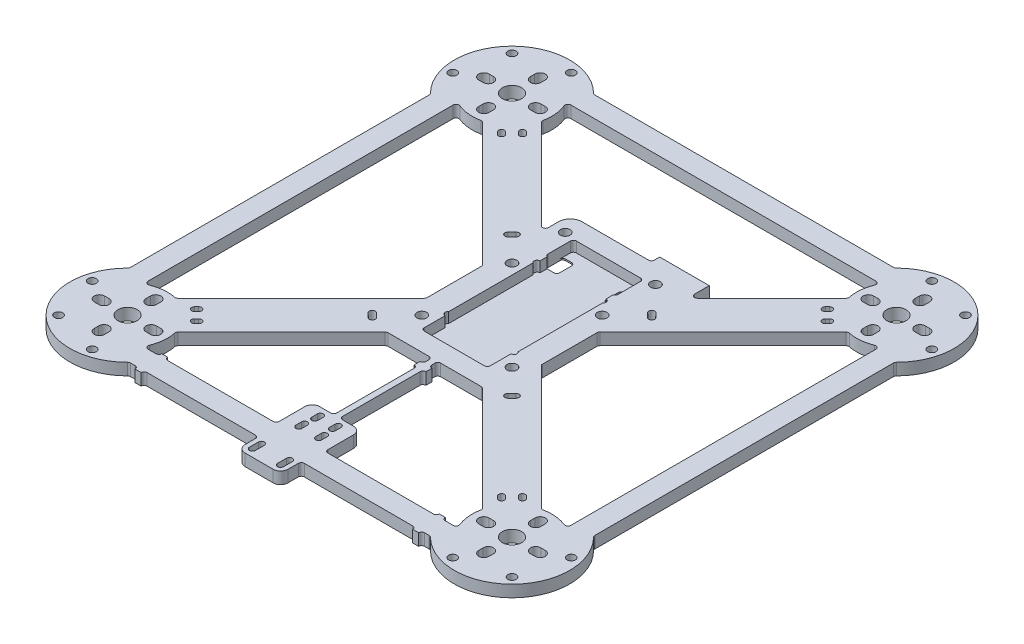
from build123d import *

# Parameters (mm, degrees)
BASE_SHAPE_DEPTH           = 4
MOTOR_MOUNTING_HOLES_REACH = 113.088
SKETCH2_R                  = 3.25
OSD_COVER_DEPTH            = 4
MAIN_HOLES_REACH           = 113.088
SKETCH7_R                  = 1.65
SKETCH8_W                  = 7.5
SKETCH8_H                  = 7
SKETCH8_W_2                = 2
SKETCH8_H_2                = 34.8
SKETCH8_H_3                = 12.2
SKETCH8_H_4                = 1.6
VTX_MOUNT_DEPTH            = 4
SKETCH9_R                  = 1
ESC_CUTS_DEPTH             = 4
MOTOR_START                = -4
MOTOR_PROTECTORS_OUTLINE_R = 1.4
MOTOR_PROTECTORS_DEPTH     = 4
VTX_START                  = -3.5
VTX_POCKET_DEPTH           = 3.5
SKETCH13_W                 = 4
SKETCH13_H                 = 2
SKETCH13_W_2               = 2
SKETCH13_H_2               = 1
CLIP_RETAINERS_DEPTH       = 4
MILLING_FILLETS_R          = 1


with BuildPart() as part:
    # Sketch1 → Base shape (new body)
    with BuildSketch(Plane(origin=(0, 0, 0), x_dir=(1, 0, 0), z_dir=(0, 1, 0))):
        with BuildLine():
            Line((78.5, -65), (78.5, 65))
            ThreePointArc((78.5, 65), (74.5459415, 74.545941592), (64.999999869, 78.5))
            Line((64.999999869, 78.5), (-65, 78.5))
            ThreePointArc((-65, 78.5), (-74.545941546, 74.545941546), (-78.5, 65))
            Line((-78.5, 65), (-78.5, -65))
            ThreePointArc((-78.5, -65), (-74.545941546, -74.545941546), (-65, -78.5))
            Line((-65, -78.5), (65, -78.5))
            ThreePointArc((65, -78.5), (74.545941546, -74.545941546), (78.5, -65))
        make_face()
        with BuildLine():
            Line((0, -9.899494937), (51.887838673, -61.78733361))
            ThreePointArc((51.887838673, -61.78733361), (51.615727203, -66.763871223), (53.167840434, -71.5))
            Line((53.167840434, -71.5), (-53.167840434, -71.5))
            ThreePointArc((-53.167840434, -71.5), (-51.615727203, -66.763871223), (-51.887838673, -61.78733361))
            Line((-51.887838673, -61.78733361), (0, -9.899494937))
        make_face(mode=Mode.SUBTRACT)
        with BuildLine():
            Line((-61.78733361, 51.887838673), (-9.899494937, 0))
            Line((-9.899494937, 0), (-61.78733361, -51.887838673))
            ThreePointArc((-61.78733361, -51.887838673), (-66.763871223, -51.615727203), (-71.5, -53.167840434))
            Line((-71.5, -53.167840434), (-71.5, 53.167840434))
            ThreePointArc((-71.5, 53.167840434), (-66.763871223, 51.615727203), (-61.78733361, 51.887838673))
        make_face(mode=Mode.SUBTRACT)
        with BuildLine():
            Line((61.78733361, -51.887838673), (9.899494937, 0))
            Line((9.899494937, 0), (61.78733361, 51.887838673))
            ThreePointArc((61.78733361, 51.887838673), (66.763871223, 51.615727203), (71.5, 53.167840434))
            Line((71.5, 53.167840434), (71.5, -53.167840434))
            ThreePointArc((71.5, -53.167840434), (66.763871223, -51.615727203), (61.78733361, -51.887838673))
        make_face(mode=Mode.SUBTRACT)
        with BuildLine():
            Line((51.887838673, 61.78733361), (0, 9.899494937))
            Line((0, 9.899494937), (-51.887838673, 61.78733361))
            ThreePointArc((-51.887838673, 61.78733361), (-51.615727203, 66.763871223), (-53.167840434, 71.5))
            Line((-53.167840434, 71.5), (53.167840434, 71.5))
            ThreePointArc((53.167840434, 71.5), (51.615727203, 66.763871223), (51.887838673, 61.78733361))
        make_face(mode=Mode.SUBTRACT)
    extrude(amount=BASE_SHAPE_DEPTH)

    # Sketch2 → Motor mounting holes (cut, up to next)
    with BuildSketch(Plane(origin=(0, 4, 0), x_dir=(1, 0, 0), z_dir=(0, 1, 0)), mode=Mode.PRIVATE) as motor_mounting_holes_sk1:
        with BuildLine():
            ThreePointArc((-66.75, 73), (-65, 71.25), (-63.25, 73))
            Line((-63.25, 73), (-63.25, 74.337424698))
            ThreePointArc((-63.25, 74.337424698), (-63.253719245, 74.338120985), (-63.257438767, 74.338815789))
            ThreePointArc((-63.257438767, 74.338815789), (-65, 76.25), (-66.742561233, 74.338815789))
            ThreePointArc((-66.742561233, 74.338815789), (-66.746280755, 74.338120985), (-66.75, 74.337424698))
            Line((-66.75, 74.337424698), (-66.75, 73))
        make_face()
    motor_mounting_holes_tool1 = extrude(motor_mounting_holes_sk1.sketch, amount=-MOTOR_MOUNTING_HOLES_REACH, mode=Mode.PRIVATE) & part.part
    # Sketch2 → Motor mounting holes (cut, up to next)
    with BuildSketch(Plane(origin=(0, 4, 0), x_dir=(1, 0, 0), z_dir=(0, 1, 0)), mode=Mode.PRIVATE) as motor_mounting_holes_sk2:
        with BuildLine():
            Line((-73, 66.75), (-74.337424698, 66.75))
            ThreePointArc((-74.337424698, 66.75), (-74.338120985, 66.746280755), (-74.338815789, 66.742561233))
            ThreePointArc((-74.338815789, 66.742561233), (-76.25, 65), (-74.338815789, 63.257438767))
            ThreePointArc((-74.338815789, 63.257438767), (-74.338120985, 63.253719245), (-74.337424698, 63.25))
            Line((-74.337424698, 63.25), (-73, 63.25))
            ThreePointArc((-73, 63.25), (-71.25, 65), (-73, 66.75))
        make_face()
    motor_mounting_holes_tool2 = extrude(motor_mounting_holes_sk2.sketch, amount=-MOTOR_MOUNTING_HOLES_REACH, mode=Mode.PRIVATE) & part.part
    # Sketch2 → Motor mounting holes (cut, up to next)
    with BuildSketch(Plane(origin=(0, 4, 0), x_dir=(1, 0, 0), z_dir=(0, 1, 0)), mode=Mode.PRIVATE) as motor_mounting_holes_sk3:
        with BuildLine():
            ThreePointArc((-55.662575302, 63.25), (-55.661879015, 63.253719245), (-55.661184211, 63.257438767))
            ThreePointArc((-55.661184211, 63.257438767), (-53.75, 65), (-55.661184211, 66.742561233))
            ThreePointArc((-55.661184211, 66.742561233), (-55.661879015, 66.746280755), (-55.662575302, 66.75))
            Line((-55.662575302, 66.75), (-57, 66.75))
            ThreePointArc((-57, 66.75), (-58.75, 65), (-57, 63.25))
            Line((-57, 63.25), (-55.662575302, 63.25))
        make_face()
    motor_mounting_holes_tool3 = extrude(motor_mounting_holes_sk3.sketch, amount=-MOTOR_MOUNTING_HOLES_REACH, mode=Mode.PRIVATE) & part.part
    # Sketch2 → Motor mounting holes (cut, up to next)
    with BuildSketch(Plane(origin=(0, 4, 0), x_dir=(1, 0, 0), z_dir=(0, 1, 0)), mode=Mode.PRIVATE) as motor_mounting_holes_sk4:
        with BuildLine():
            ThreePointArc((-66.742561233, 55.661184211), (-65, 53.75), (-63.257438767, 55.661184211))
            ThreePointArc((-63.257438767, 55.661184211), (-63.253719245, 55.661879015), (-63.25, 55.662575302))
            Line((-63.25, 55.662575302), (-63.25, 57))
            ThreePointArc((-63.25, 57), (-65, 58.75), (-66.75, 57))
            Line((-66.75, 57), (-66.75, 55.662575302))
            ThreePointArc((-66.75, 55.662575302), (-66.746280755, 55.661879015), (-66.742561233, 55.661184211))
        make_face()
    motor_mounting_holes_tool4 = extrude(motor_mounting_holes_sk4.sketch, amount=-MOTOR_MOUNTING_HOLES_REACH, mode=Mode.PRIVATE) & part.part
    # Sketch2 → Motor mounting holes (cut, up to next)
    with BuildSketch(Plane(origin=(0, 4, 0), x_dir=(1, 0, 0), z_dir=(0, 1, 0)), mode=Mode.PRIVATE) as motor_mounting_holes_sk5:
        with BuildLine():
            ThreePointArc((63.25, 55.5), (65, 53.75), (66.75, 55.5))
            Line((66.75, 55.5), (66.75, 57))
            ThreePointArc((66.75, 57), (65, 58.75), (63.25, 57))
            Line((63.25, 57), (63.25, 55.5))
        make_face()
    motor_mounting_holes_tool5 = extrude(motor_mounting_holes_sk5.sketch, amount=-MOTOR_MOUNTING_HOLES_REACH, mode=Mode.PRIVATE) & part.part
    # Sketch2 → Motor mounting holes (cut, up to next)
    with BuildSketch(Plane(origin=(0, 4, 0), x_dir=(1, 0, 0), z_dir=(0, 1, 0)), mode=Mode.PRIVATE) as motor_mounting_holes_sk6:
        with BuildLine():
            ThreePointArc((74.5, 63.25), (76.25, 65), (74.5, 66.75))
            Line((74.5, 66.75), (73, 66.75))
            ThreePointArc((73, 66.75), (71.25, 65), (73, 63.25))
            Line((73, 63.25), (74.5, 63.25))
        make_face()
    motor_mounting_holes_tool6 = extrude(motor_mounting_holes_sk6.sketch, amount=-MOTOR_MOUNTING_HOLES_REACH, mode=Mode.PRIVATE) & part.part
    # Sketch2 → Motor mounting holes (cut, up to next)
    with BuildSketch(Plane(origin=(0, 4, 0), x_dir=(1, 0, 0), z_dir=(0, 1, 0)), mode=Mode.PRIVATE) as motor_mounting_holes_sk7:
        with BuildLine():
            ThreePointArc((63.25, 73), (65, 71.25), (66.75, 73))
            Line((66.75, 73), (66.75, 74.5))
            ThreePointArc((66.75, 74.5), (65, 76.25), (63.25, 74.5))
            Line((63.25, 74.5), (63.25, 73))
        make_face()
    motor_mounting_holes_tool7 = extrude(motor_mounting_holes_sk7.sketch, amount=-MOTOR_MOUNTING_HOLES_REACH, mode=Mode.PRIVATE) & part.part
    # Sketch2 → Motor mounting holes (cut, up to next)
    with BuildSketch(Plane(origin=(0, 4, 0), x_dir=(1, 0, 0), z_dir=(0, 1, 0)), mode=Mode.PRIVATE) as motor_mounting_holes_sk8:
        with BuildLine():
            ThreePointArc((55.5, 66.75), (53.75, 65), (55.5, 63.25))
            Line((55.5, 63.25), (57, 63.25))
            ThreePointArc((57, 63.25), (58.75, 65), (57, 66.75))
            Line((57, 66.75), (55.5, 66.75))
        make_face()
    motor_mounting_holes_tool8 = extrude(motor_mounting_holes_sk8.sketch, amount=-MOTOR_MOUNTING_HOLES_REACH, mode=Mode.PRIVATE) & part.part
    # Sketch2 → Motor mounting holes (cut, up to next)
    with BuildSketch(Plane(origin=(0, 4, 0), x_dir=(1, 0, 0), z_dir=(0, 1, 0)), mode=Mode.PRIVATE) as motor_mounting_holes_sk9:
        with BuildLine():
            ThreePointArc((-66.75, -57), (-65, -58.75), (-63.25, -57))
            Line((-63.25, -57), (-63.25, -55.5))
            ThreePointArc((-63.25, -55.5), (-65, -53.75), (-66.75, -55.5))
            Line((-66.75, -55.5), (-66.75, -57))
        make_face()
    motor_mounting_holes_tool9 = extrude(motor_mounting_holes_sk9.sketch, amount=-MOTOR_MOUNTING_HOLES_REACH, mode=Mode.PRIVATE) & part.part
    # Sketch2 → Motor mounting holes (cut, up to next)
    with BuildSketch(Plane(origin=(0, 4, 0), x_dir=(1, 0, 0), z_dir=(0, 1, 0)), mode=Mode.PRIVATE) as motor_mounting_holes_sk10:
        with BuildLine():
            ThreePointArc((-57, -63.25), (-58.75, -65), (-57, -66.75))
            Line((-57, -66.75), (-55.5, -66.75))
            ThreePointArc((-55.5, -66.75), (-53.75, -65), (-55.5, -63.25))
            Line((-55.5, -63.25), (-57, -63.25))
        make_face()
    motor_mounting_holes_tool10 = extrude(motor_mounting_holes_sk10.sketch, amount=-MOTOR_MOUNTING_HOLES_REACH, mode=Mode.PRIVATE) & part.part
    # Sketch2 → Motor mounting holes (cut, up to next)
    with BuildSketch(Plane(origin=(0, 4, 0), x_dir=(1, 0, 0), z_dir=(0, 1, 0)), mode=Mode.PRIVATE) as motor_mounting_holes_sk11:
        with BuildLine():
            ThreePointArc((-74.5, -63.25), (-76.25, -65), (-74.5, -66.75))
            Line((-74.5, -66.75), (-73, -66.75))
            ThreePointArc((-73, -66.75), (-71.25, -65), (-73, -63.25))
            Line((-73, -63.25), (-74.5, -63.25))
        make_face()
    motor_mounting_holes_tool11 = extrude(motor_mounting_holes_sk11.sketch, amount=-MOTOR_MOUNTING_HOLES_REACH, mode=Mode.PRIVATE) & part.part
    # Sketch2 → Motor mounting holes (cut, up to next)
    with BuildSketch(Plane(origin=(0, 4, 0), x_dir=(1, 0, 0), z_dir=(0, 1, 0)), mode=Mode.PRIVATE) as motor_mounting_holes_sk12:
        with BuildLine():
            ThreePointArc((-63.25, -73), (-65, -71.25), (-66.75, -73))
            Line((-66.75, -73), (-66.75, -74.5))
            ThreePointArc((-66.75, -74.5), (-65, -76.25), (-63.25, -74.5))
            Line((-63.25, -74.5), (-63.25, -73))
        make_face()
    motor_mounting_holes_tool12 = extrude(motor_mounting_holes_sk12.sketch, amount=-MOTOR_MOUNTING_HOLES_REACH, mode=Mode.PRIVATE) & part.part
    # Sketch2 → Motor mounting holes (cut, up to next)
    with BuildSketch(Plane(origin=(0, 4, 0), x_dir=(1, 0, 0), z_dir=(0, 1, 0)), mode=Mode.PRIVATE) as motor_mounting_holes_sk13:
        with BuildLine():
            ThreePointArc((55.5, -63.25), (53.75, -65), (55.5, -66.75))
            Line((55.5, -66.75), (57, -66.75))
            ThreePointArc((57, -66.75), (58.75, -65), (57, -63.25))
            Line((57, -63.25), (55.5, -63.25))
        make_face()
    motor_mounting_holes_tool13 = extrude(motor_mounting_holes_sk13.sketch, amount=-MOTOR_MOUNTING_HOLES_REACH, mode=Mode.PRIVATE) & part.part
    # Sketch2 → Motor mounting holes (cut, up to next)
    with BuildSketch(Plane(origin=(0, 4, 0), x_dir=(1, 0, 0), z_dir=(0, 1, 0)), mode=Mode.PRIVATE) as motor_mounting_holes_sk14:
        with BuildLine():
            ThreePointArc((66.75, -73), (65, -71.25), (63.25, -73))
            Line((63.25, -73), (63.25, -74.5))
            ThreePointArc((63.25, -74.5), (65, -76.25), (66.75, -74.5))
            Line((66.75, -74.5), (66.75, -73))
        make_face()
    motor_mounting_holes_tool14 = extrude(motor_mounting_holes_sk14.sketch, amount=-MOTOR_MOUNTING_HOLES_REACH, mode=Mode.PRIVATE) & part.part
    # Sketch2 → Motor mounting holes (cut, up to next)
    with BuildSketch(Plane(origin=(0, 4, 0), x_dir=(1, 0, 0), z_dir=(0, 1, 0)), mode=Mode.PRIVATE) as motor_mounting_holes_sk15:
        with BuildLine():
            ThreePointArc((74.5, -66.75), (76.25, -65), (74.5, -63.25))
            Line((74.5, -63.25), (73, -63.25))
            ThreePointArc((73, -63.25), (71.25, -65), (73, -66.75))
            Line((73, -66.75), (74.5, -66.75))
        make_face()
    motor_mounting_holes_tool15 = extrude(motor_mounting_holes_sk15.sketch, amount=-MOTOR_MOUNTING_HOLES_REACH, mode=Mode.PRIVATE) & part.part
    # Sketch2 → Motor mounting holes (cut, up to next)
    with BuildSketch(Plane(origin=(0, 4, 0), x_dir=(1, 0, 0), z_dir=(0, 1, 0)), mode=Mode.PRIVATE) as motor_mounting_holes_sk16:
        with BuildLine():
            ThreePointArc((66.75, -55.5), (65, -53.75), (63.25, -55.5))
            Line((63.25, -55.5), (63.25, -57))
            ThreePointArc((63.25, -57), (65, -58.75), (66.75, -57))
            Line((66.75, -57), (66.75, -55.5))
        make_face()
    motor_mounting_holes_tool16 = extrude(motor_mounting_holes_sk16.sketch, amount=-MOTOR_MOUNTING_HOLES_REACH, mode=Mode.PRIVATE) & part.part
    # Sketch2 → Motor mounting holes (cut, up to next)
    with BuildSketch(Plane(origin=(0, 4, 0), x_dir=(1, 0, 0), z_dir=(0, 1, 0)), mode=Mode.PRIVATE) as motor_mounting_holes_sk17:
        with Locations(Location((-65, 65, 0), (0, 0, 270))):
            Circle(SKETCH2_R)
    motor_mounting_holes_tool17 = extrude(motor_mounting_holes_sk17.sketch, amount=-MOTOR_MOUNTING_HOLES_REACH, mode=Mode.PRIVATE) & part.part
    # Sketch2 → Motor mounting holes (cut, up to next)
    with BuildSketch(Plane(origin=(0, 4, 0), x_dir=(1, 0, 0), z_dir=(0, 1, 0)), mode=Mode.PRIVATE) as motor_mounting_holes_sk18:
        with Locations(Location((65, 65, 0), (0, 0, 270))):
            Circle(SKETCH2_R)
    motor_mounting_holes_tool18 = extrude(motor_mounting_holes_sk18.sketch, amount=-MOTOR_MOUNTING_HOLES_REACH, mode=Mode.PRIVATE) & part.part
    # Sketch2 → Motor mounting holes (cut, up to next)
    with BuildSketch(Plane(origin=(0, 4, 0), x_dir=(1, 0, 0), z_dir=(0, 1, 0)), mode=Mode.PRIVATE) as motor_mounting_holes_sk19:
        with Locations(Location((65, -65, 0), (0, 0, 270))):
            Circle(SKETCH2_R)
    motor_mounting_holes_tool19 = extrude(motor_mounting_holes_sk19.sketch, amount=-MOTOR_MOUNTING_HOLES_REACH, mode=Mode.PRIVATE) & part.part
    # Sketch2 → Motor mounting holes (cut, up to next)
    with BuildSketch(Plane(origin=(0, 4, 0), x_dir=(1, 0, 0), z_dir=(0, 1, 0)), mode=Mode.PRIVATE) as motor_mounting_holes_sk20:
        with Locations(Location((-65, -65, 0), (0, 0, 270))):
            Circle(SKETCH2_R)
    motor_mounting_holes_tool20 = extrude(motor_mounting_holes_sk20.sketch, amount=-MOTOR_MOUNTING_HOLES_REACH, mode=Mode.PRIVATE) & part.part
    add(motor_mounting_holes_tool1.solids().sort_by_distance((-65, 4, -73.749966))[0], mode=Mode.SUBTRACT)
    add(motor_mounting_holes_tool2.solids().sort_by_distance((-73.749966, 4, -65))[0], mode=Mode.SUBTRACT)
    add(motor_mounting_holes_tool3.solids().sort_by_distance((-56.250034, 4, -65))[0], mode=Mode.SUBTRACT)
    add(motor_mounting_holes_tool4.solids().sort_by_distance((-65, 4, -56.250034))[0], mode=Mode.SUBTRACT)
    add(motor_mounting_holes_tool5.solids().sort_by_distance((65, 4, -56.25))[0], mode=Mode.SUBTRACT)
    add(motor_mounting_holes_tool6.solids().sort_by_distance((73.75, 4, -65))[0], mode=Mode.SUBTRACT)
    add(motor_mounting_holes_tool7.solids().sort_by_distance((65, 4, -73.75))[0], mode=Mode.SUBTRACT)
    add(motor_mounting_holes_tool8.solids().sort_by_distance((56.25, 4, -65))[0], mode=Mode.SUBTRACT)
    add(motor_mounting_holes_tool9.solids().sort_by_distance((-65, 4, 56.25))[0], mode=Mode.SUBTRACT)
    add(motor_mounting_holes_tool10.solids().sort_by_distance((-56.25, 4, 65))[0], mode=Mode.SUBTRACT)
    add(motor_mounting_holes_tool11.solids().sort_by_distance((-73.75, 4, 65))[0], mode=Mode.SUBTRACT)
    add(motor_mounting_holes_tool12.solids().sort_by_distance((-65, 4, 73.75))[0], mode=Mode.SUBTRACT)
    add(motor_mounting_holes_tool13.solids().sort_by_distance((56.25, 4, 65))[0], mode=Mode.SUBTRACT)
    add(motor_mounting_holes_tool14.solids().sort_by_distance((65, 4, 73.75))[0], mode=Mode.SUBTRACT)
    add(motor_mounting_holes_tool15.solids().sort_by_distance((73.75, 4, 65))[0], mode=Mode.SUBTRACT)
    add(motor_mounting_holes_tool16.solids().sort_by_distance((65, 4, 56.25))[0], mode=Mode.SUBTRACT)
    add(motor_mounting_holes_tool17.solids().sort_by_distance((-65, 4, -65))[0], mode=Mode.SUBTRACT)
    add(motor_mounting_holes_tool18.solids().sort_by_distance((65, 4, -65))[0], mode=Mode.SUBTRACT)
    add(motor_mounting_holes_tool19.solids().sort_by_distance((65, 4, 65))[0], mode=Mode.SUBTRACT)
    add(motor_mounting_holes_tool20.solids().sort_by_distance((-65, 4, 65))[0], mode=Mode.SUBTRACT)

    # Sketch5 → OSD cover (add)
    with BuildSketch(Plane.XZ):
        Polygon((-19.5, 9.600505063), (-19.5, -9.600505063), (-9.899494937, 0), align=None)
        Polygon((0, 9.899494937), (16.200505063, 26.1), (-16.200505063, 26.1), align=None)
        with BuildLine():
            Line((-19.5, -29.399494937), (-19.5, -35.2))
            ThreePointArc((-19.5, -35.2), (-18.328427125, -38.028427125), (-15.5, -39.2))
            Line((-15.5, -39.2), (6.95, -39.2))
            ThreePointArc((6.95, -39.2), (7.657106781, -39.492893219), (7.95, -40.2))
            Line((7.95, -40.2), (7.95, -42))
            Line((7.95, -42), (24.7, -42))
            Line((24.7, -42), (24.7, -34.599494937))
            Line((24.7, -34.599494937), (0, -9.899494937))
            Line((0, -9.899494937), (-19.5, -29.399494937))
        make_face()
        Polygon((19.5, -9.600505063), (19.5, 9.600505063), (9.899494937, 0), align=None)
    extrude(amount=-OSD_COVER_DEPTH)

    # Sketch7 → Main holes (cut, up to next)
    with BuildSketch(Plane(origin=(0, 4, 0), x_dir=(1, 0, 0), z_dir=(0, 1, 0)), mode=Mode.PRIVATE) as main_holes_sk1:
        with BuildLine():
            Line((-10.85, 23), (-8.85, 23))
            ThreePointArc((-8.85, 23), (-8.142893219, 23.292893219), (-7.85, 24))
            Line((-7.85, 24), (-7.85, 28))
            ThreePointArc((-7.85, 28), (-8.142893219, 28.707106781), (-8.85, 29))
            Line((-8.85, 29), (-10.85, 29))
            ThreePointArc((-10.85, 29), (-11.557106781, 28.707106781), (-11.85, 28))
            Line((-11.85, 28), (-11.85, 24))
            ThreePointArc((-11.85, 24), (-11.557106781, 23.292893219), (-10.85, 23))
        make_face()
    main_holes_tool1 = extrude(main_holes_sk1.sketch, amount=-MAIN_HOLES_REACH, mode=Mode.PRIVATE) & part.part
    # Sketch7 → Main holes (cut, up to next)
    with BuildSketch(Plane(origin=(0, 4, 0), x_dir=(1, 0, 0), z_dir=(0, 1, 0)), mode=Mode.PRIVATE) as main_holes_sk2:
        with BuildLine():
            Line((10.85, 29), (8.85, 29))
            ThreePointArc((8.85, 29), (8.142893219, 28.707106781), (7.85, 28))
            Line((7.85, 28), (7.85, 24))
            ThreePointArc((7.85, 24), (8.142893219, 23.292893219), (8.85, 23))
            Line((8.85, 23), (10.85, 23))
            ThreePointArc((10.85, 23), (11.557106781, 23.292893219), (11.85, 24))
            Line((11.85, 24), (11.85, 28))
            ThreePointArc((11.85, 28), (11.557106781, 28.707106781), (10.85, 29))
        make_face()
    main_holes_tool2 = extrude(main_holes_sk2.sketch, amount=-MAIN_HOLES_REACH, mode=Mode.PRIVATE) & part.part
    # Sketch7 → Main holes (cut, up to next)
    with BuildSketch(Plane(origin=(0, 4, 0), x_dir=(1, 0, 0), z_dir=(0, 1, 0)), mode=Mode.PRIVATE) as main_holes_sk3:
        with Locations(Location((-15.25, -15.25, 0), (0, 0, 270))):
            Circle(SKETCH7_R)
    main_holes_tool3 = extrude(main_holes_sk3.sketch, amount=-MAIN_HOLES_REACH, mode=Mode.PRIVATE) & part.part
    # Sketch7 → Main holes (cut, up to next)
    with BuildSketch(Plane(origin=(0, 4, 0), x_dir=(1, 0, 0), z_dir=(0, 1, 0)), mode=Mode.PRIVATE) as main_holes_sk4:
        with Locations(Location((-15.25, 15.25, 0), (0, 0, 270))):
            Circle(SKETCH7_R)
    main_holes_tool4 = extrude(main_holes_sk4.sketch, amount=-MAIN_HOLES_REACH, mode=Mode.PRIVATE) & part.part
    # Sketch7 → Main holes (cut, up to next)
    with BuildSketch(Plane(origin=(0, 4, 0), x_dir=(1, 0, 0), z_dir=(0, 1, 0)), mode=Mode.PRIVATE) as main_holes_sk5:
        with Locations(Location((-15.25, 33.25, 0), (0, 0, 270))):
            Circle(SKETCH7_R)
    main_holes_tool5 = extrude(main_holes_sk5.sketch, amount=-MAIN_HOLES_REACH, mode=Mode.PRIVATE) & part.part
    # Sketch7 → Main holes (cut, up to next)
    with BuildSketch(Plane(origin=(0, 4, 0), x_dir=(1, 0, 0), z_dir=(0, 1, 0)), mode=Mode.PRIVATE) as main_holes_sk6:
        with Locations(Location((15.25, 33.25, 0), (0, 0, 270))):
            Circle(SKETCH7_R)
    main_holes_tool6 = extrude(main_holes_sk6.sketch, amount=-MAIN_HOLES_REACH, mode=Mode.PRIVATE) & part.part
    # Sketch7 → Main holes (cut, up to next)
    with BuildSketch(Plane(origin=(0, 4, 0), x_dir=(1, 0, 0), z_dir=(0, 1, 0)), mode=Mode.PRIVATE) as main_holes_sk7:
        with Locations(Location((15.25, 15.25, 0), (0, 0, 270))):
            Circle(SKETCH7_R)
    main_holes_tool7 = extrude(main_holes_sk7.sketch, amount=-MAIN_HOLES_REACH, mode=Mode.PRIVATE) & part.part
    # Sketch7 → Main holes (cut, up to next)
    with BuildSketch(Plane(origin=(0, 4, 0), x_dir=(1, 0, 0), z_dir=(0, 1, 0)), mode=Mode.PRIVATE) as main_holes_sk8:
        with Locations(Location((15.25, -15.25, 0), (0, 0, 270))):
            Circle(SKETCH7_R)
    main_holes_tool8 = extrude(main_holes_sk8.sketch, amount=-MAIN_HOLES_REACH, mode=Mode.PRIVATE) & part.part
    add(main_holes_tool1.solids().sort_by_distance((-9.85, 4, -26))[0], mode=Mode.SUBTRACT)
    add(main_holes_tool2.solids().sort_by_distance((9.85, 4, -26))[0], mode=Mode.SUBTRACT)
    add(main_holes_tool3.solids().sort_by_distance((-15.25, 4, 15.25))[0], mode=Mode.SUBTRACT)
    add(main_holes_tool4.solids().sort_by_distance((-15.25, 4, -15.25))[0], mode=Mode.SUBTRACT)
    add(main_holes_tool5.solids().sort_by_distance((-15.25, 4, -33.25))[0], mode=Mode.SUBTRACT)
    add(main_holes_tool6.solids().sort_by_distance((15.25, 4, -33.25))[0], mode=Mode.SUBTRACT)
    add(main_holes_tool7.solids().sort_by_distance((15.25, 4, -15.25))[0], mode=Mode.SUBTRACT)
    add(main_holes_tool8.solids().sort_by_distance((15.25, 4, 15.25))[0], mode=Mode.SUBTRACT)

    # Sketch8 → VTX mount (add)
    # profile 1 of 11: a face of its own
    with BuildSketch(Plane.XZ):
        with BuildLine():
            Line((-7.25, 78.5), (-3.75, 78.5))
            Line((-3.75, 78.5), (-3.75, 80))
            ThreePointArc((-3.75, 80), (-4.75, 79), (-5.75, 80))
            Line((-5.75, 80), (-5.75, 83))
            ThreePointArc((-5.75, 83), (-4.75, 84), (-3.75, 83))
            Line((-3.75, 83), (-3.75, 85.5))
            Line((-3.75, 85.5), (-4.75, 85.5))
            ThreePointArc((-4.75, 85.5), (-6.517766953, 84.767766953), (-7.25, 83))
            Line((-7.25, 83), (-7.25, 78.5))
        make_face()
    # profile 2 of 11: a face of its own
    with BuildSketch(Plane.XZ):
        with Locations((0, 82)):
            Rectangle(SKETCH8_W, SKETCH8_H)
    # profile 3 of 11: a face of its own
    with BuildSketch(Plane.XZ):
        with BuildLine():
            Line((3.75, 80), (3.75, 78.5))
            Line((3.75, 78.5), (7.25, 78.5))
            Line((7.25, 78.5), (7.25, 83))
            ThreePointArc((7.25, 83), (6.517766953, 84.767766953), (4.75, 85.5))
            Line((4.75, 85.5), (3.75, 85.5))
            Line((3.75, 85.5), (3.75, 83))
            ThreePointArc((3.75, 83), (4.75, 84), (5.75, 83))
            Line((5.75, 83), (5.75, 80))
            ThreePointArc((5.75, 80), (4.75, 79), (3.75, 80))
        make_face()
    # profile 4 of 11: a face of its own
    with BuildSketch(Plane.XZ):
        with BuildLine():
            Line((1, 71.5), (1, 59.3))
            Line((1, 59.3), (5.75, 59.3))
            ThreePointArc((5.75, 59.3), (7.517766953, 60.032233047), (8.25, 61.8))
            Line((8.25, 61.8), (8.25, 71.5))
            Line((8.25, 71.5), (1, 71.5))
        make_face()
        with BuildLine():
            Line((2, 61.8), (2, 63.7))
            ThreePointArc((2, 63.7), (3, 64.7), (4, 63.7))
            Line((4, 63.7), (4, 61.8))
            ThreePointArc((4, 61.8), (3, 60.8), (2, 61.8))
        make_face(mode=Mode.SUBTRACT)
        with BuildLine():
            Line((2.35, 66.8), (2.35, 68.7))
            ThreePointArc((2.35, 68.7), (3.35, 69.7), (4.35, 68.7))
            Line((4.35, 68.7), (4.35, 66.8))
            ThreePointArc((4.35, 66.8), (3.35, 65.8), (2.35, 66.8))
        make_face(mode=Mode.SUBTRACT)
    # profile 5 of 11: a face of its own
    with BuildSketch(Plane.XZ):
        with BuildLine():
            Line((-5.75, 59.3), (-1, 59.3))
            Line((-1, 59.3), (-1, 71.5))
            Line((-1, 71.5), (-8.25, 71.5))
            Line((-8.25, 71.5), (-8.25, 61.8))
            ThreePointArc((-8.25, 61.8), (-7.517766953, 60.032233047), (-5.75, 59.3))
        make_face()
        with BuildLine():
            ThreePointArc((-4, 63.7), (-3, 64.7), (-2, 63.7))
            Line((-2, 63.7), (-2, 61.8))
            ThreePointArc((-2, 61.8), (-3, 60.8), (-4, 61.8))
            Line((-4, 61.8), (-4, 63.7))
        make_face(mode=Mode.SUBTRACT)
        with BuildLine():
            ThreePointArc((-4.35, 68.7), (-3.35, 69.7), (-2.35, 68.7))
            Line((-2.35, 68.7), (-2.35, 66.8))
            ThreePointArc((-2.35, 66.8), (-3.35, 65.8), (-4.35, 66.8))
            Line((-4.35, 66.8), (-4.35, 68.7))
        make_face(mode=Mode.SUBTRACT)
    # profile 6 of 11: a face of its own
    with BuildSketch(Plane.XZ):
        with Locations((0, 41.9)):
            Rectangle(SKETCH8_W_2, SKETCH8_H_2)
    # profile 7 of 11: a face of its own
    with BuildSketch(Plane.XZ):
        with Locations((0, 65.4)):
            Rectangle(SKETCH8_W_2, SKETCH8_H_3)
    # profile 8 of 11: a face of its own
    with BuildSketch(Plane.XZ):
        with Locations((0, 25.3)):
            Rectangle(SKETCH8_W_2, SKETCH8_H_4)
    # profile 9 of 11: a face of its own
    with BuildSketch(Plane.XZ):
        with Locations((0, 25.3)):
            Rectangle(SKETCH8_W_2, SKETCH8_H_4)
    # profile 10 of 11: a face of its own
    with BuildSketch(Plane.XZ):
        with Locations((0, 25.3)):
            Rectangle(SKETCH8_W_2, SKETCH8_H_4)
    # profile 11 of 11: a face of its own
    with BuildSketch(Plane.XZ):
        with Locations((0, 25.3)):
            Rectangle(SKETCH8_W_2, SKETCH8_H_4)
    extrude(amount=-VTX_MOUNT_DEPTH)

    # Sketch9 → ESC cuts (cut)
    with BuildSketch(Plane.XZ):
        with Locations((24.332233047, 22.918019485)):
            Circle(SKETCH9_R)
        with Locations((22.918019485, 24.332233047)):
            Circle(SKETCH9_R)
        with BuildLine():
            ThreePointArc((23.918019485, 24.332233047), (23.841899017, 23.949549615), (23.625126266, 23.625126266))
            ThreePointArc((23.625126266, 23.625126266), (24.332233058, 23.918019485), (25.039339844, 23.62512625))
            Line((25.039339844, 23.62512625), (23.625126266, 25.039339828))
            ThreePointArc((23.625126266, 25.039339828), (23.841899017, 24.714916479), (23.918019485, 24.332233047))
        make_face()
        with BuildLine():
            ThreePointArc((23.625126266, 23.625126266), (22.918019478, 23.332233047), (22.210912694, 23.625126276))
            Line((22.210912694, 23.625126276), (23.62512626, 22.21091271))
            ThreePointArc((23.62512626, 22.21091271), (23.332233047, 22.918019489), (23.625126266, 23.625126266))
        make_face()
        with Locations((-24.332233047, 22.918019485)):
            Circle(SKETCH9_R)
        with Locations((-22.918019485, 24.332233047)):
            Circle(SKETCH9_R)
        with BuildLine():
            Line((-23.625126266, 22.210912703), (-22.21091271, 23.62512626))
            ThreePointArc((-22.21091271, 23.62512626), (-22.918019489, 23.332233047), (-23.625126266, 23.625126266))
            ThreePointArc((-23.625126266, 23.625126266), (-23.408353515, 23.300702917), (-23.332233047, 22.918019485))
            ThreePointArc((-23.332233047, 22.918019485), (-23.408353515, 22.535336052), (-23.625126266, 22.210912703))
        make_face()
        with BuildLine():
            ThreePointArc((-23.625126266, 23.625126266), (-23.918019485, 24.332233047), (-23.625126266, 25.039339828))
            Line((-23.625126266, 25.039339828), (-25.039339828, 23.625126266))
            ThreePointArc((-25.039339828, 23.625126266), (-24.332233047, 23.918019485), (-23.625126266, 23.625126266))
        make_face()
        with BuildLine():
            Line((-25.039339828, -23.625126266), (-23.625126266, -25.039339828))
            ThreePointArc((-23.625126266, -25.039339828), (-23.918019485, -24.33223305), (-23.62512627, -23.62512627))
            ThreePointArc((-23.62512627, -23.62512627), (-24.33223305, -23.918019485), (-25.039339828, -23.625126266))
        make_face()
        with Locations((-24.332233047, -22.918019485)):
            Circle(SKETCH9_R)
        with BuildLine():
            ThreePointArc((-23.332233047, -22.918019485), (-23.408353516, -23.30070292), (-23.62512627, -23.62512627))
            ThreePointArc((-23.62512627, -23.62512627), (-22.918019483, -23.332233047), (-22.210912697, -23.625126272))
            Line((-22.210912697, -23.625126272), (-23.625126266, -22.210912703))
            ThreePointArc((-23.625126266, -22.210912703), (-23.408353515, -22.535336052), (-23.332233047, -22.918019485))
        make_face()
        with Locations((-22.918019485, -24.332233047)):
            Circle(SKETCH9_R)
        with Locations((22.918019485, -24.332233047)):
            Circle(SKETCH9_R)
        with Locations((24.332233047, -22.918019485)):
            Circle(SKETCH9_R)
        with BuildLine():
            ThreePointArc((23.918019485, -24.332233047), (23.841899017, -24.714916479), (23.625126266, -25.039339828))
            Line((23.625126266, -25.039339828), (25.039339828, -23.625126266))
            ThreePointArc((25.039339828, -23.625126266), (24.33223305, -23.918019485), (23.62512627, -23.62512627))
            ThreePointArc((23.62512627, -23.62512627), (23.841899018, -23.949549617), (23.918019485, -24.332233047))
        make_face()
        with BuildLine():
            Line((23.62512627, -22.2109127), (22.21091271, -23.62512626))
            ThreePointArc((22.21091271, -23.62512626), (22.918019492, -23.332233047), (23.62512627, -23.62512627))
            ThreePointArc((23.62512627, -23.62512627), (23.332233047, -22.918019485), (23.62512627, -22.2109127))
        make_face()
        with Locations((55.444931419, 51.909397513)):
            Circle(SKETCH9_R)
        with Locations((54.737824638, 51.202290732)):
            Circle(SKETCH9_R)
        with BuildLine():
            Line((54.737824638, 52.616504294), (54.030717884, 51.909397541))
            ThreePointArc((54.030717884, 51.909397541), (54.237824655, 52.068316146), (54.479005593, 52.168216558))
            ThreePointArc((54.479005593, 52.168216558), (54.578906015, 52.409397513), (54.737824638, 52.616504294))
        make_face()
        with BuildLine():
            ThreePointArc((55.703750464, 50.943471687), (55.603850042, 50.702290732), (55.444931419, 50.495183951))
            Line((55.444931419, 50.495183951), (56.1520382, 51.202290732))
            ThreePointArc((56.1520382, 51.202290732), (55.944931419, 51.04337211), (55.703750464, 50.943471687))
        make_face()
        with Locations((51.202290732, 54.737824638)):
            Circle(SKETCH9_R)
        with Locations((51.909397513, 55.444931419)):
            Circle(SKETCH9_R)
        with BuildLine():
            Line((51.202290731, 56.152038199), (50.495183951, 55.444931419))
            ThreePointArc((50.495183951, 55.444931419), (50.702290732, 55.603850042), (50.943471687, 55.703750464))
            ThreePointArc((50.943471687, 55.703750464), (51.043372109, 55.944931418), (51.202290731, 56.152038199))
        make_face()
        with BuildLine():
            ThreePointArc((52.168216558, 54.479005593), (52.068316136, 54.237824638), (51.909397513, 54.030717857))
            Line((51.909397513, 54.030717857), (52.616504294, 54.737824638))
            ThreePointArc((52.616504294, 54.737824638), (52.409397513, 54.578906015), (52.168216558, 54.479005593))
        make_face()
        with Locations((-51.202290732, 54.737824638)):
            Circle(SKETCH9_R)
        with Locations((-51.909397513, 55.444931419)):
            Circle(SKETCH9_R)
        with BuildLine():
            Line((-52.616504294, 54.737824638), (-51.909397513, 54.030717857))
            ThreePointArc((-51.909397513, 54.030717857), (-52.068316136, 54.237824638), (-52.168216558, 54.479005593))
            ThreePointArc((-52.168216558, 54.479005593), (-52.409397513, 54.578906015), (-52.616504294, 54.737824638))
        make_face()
        with BuildLine():
            ThreePointArc((-50.943471687, 55.703750464), (-50.702290732, 55.603850042), (-50.495183951, 55.444931419))
            Line((-50.495183951, 55.444931419), (-51.202290732, 56.1520382))
            ThreePointArc((-51.202290732, 56.1520382), (-51.04337211, 55.944931419), (-50.943471687, 55.703750464))
        make_face()
        with Locations((-54.737824638, 51.202290732)):
            Circle(SKETCH9_R)
        with Locations((-55.444931419, 51.909397513)):
            Circle(SKETCH9_R)
        with BuildLine():
            ThreePointArc((-54.737824638, 52.616504294), (-54.578906015, 52.409397513), (-54.479005593, 52.168216558))
            ThreePointArc((-54.479005593, 52.168216558), (-54.237824638, 52.068316136), (-54.030717857, 51.909397513))
            Line((-54.030717857, 51.909397513), (-54.737824638, 52.616504294))
        make_face()
        with BuildLine():
            Line((-56.1520382, 51.202290732), (-55.444931419, 50.495183951))
            ThreePointArc((-55.444931419, 50.495183951), (-55.603850042, 50.702290732), (-55.703750464, 50.943471687))
            ThreePointArc((-55.703750464, 50.943471687), (-55.944931419, 51.04337211), (-56.1520382, 51.202290732))
        make_face()
        with Locations((-54.737824638, -51.202290732)):
            Circle(SKETCH9_R)
        with Locations((-55.444931419, -51.909397513)):
            Circle(SKETCH9_R)
        with BuildLine():
            ThreePointArc((-55.703750464, -50.943471687), (-55.603850042, -50.702290732), (-55.444931419, -50.495183951))
            Line((-55.444931419, -50.495183951), (-56.1520382, -51.202290732))
            ThreePointArc((-56.1520382, -51.202290732), (-55.944931419, -51.04337211), (-55.703750464, -50.943471687))
        make_face()
        with BuildLine():
            Line((-54.737824638, -52.616504294), (-54.030717857, -51.909397513))
            ThreePointArc((-54.030717857, -51.909397513), (-54.237824638, -52.068316136), (-54.479005593, -52.168216558))
            ThreePointArc((-54.479005593, -52.168216558), (-54.578906015, -52.409397513), (-54.737824638, -52.616504294))
        make_face()
        with Locations((-51.202290732, -54.737824638)):
            Circle(SKETCH9_R)
        with Locations((-51.909397513, -55.444931419)):
            Circle(SKETCH9_R)
        with BuildLine():
            ThreePointArc((-52.168216558, -54.479005593), (-52.068316136, -54.237824638), (-51.909397513, -54.030717857))
            Line((-51.909397513, -54.030717857), (-52.616504294, -54.737824638))
            ThreePointArc((-52.616504294, -54.737824638), (-52.409397513, -54.578906015), (-52.168216558, -54.479005593))
        make_face()
        with BuildLine():
            Line((-51.202290732, -56.1520382), (-50.495183951, -55.444931419))
            ThreePointArc((-50.495183951, -55.444931419), (-50.702290732, -55.603850042), (-50.943471687, -55.703750464))
            ThreePointArc((-50.943471687, -55.703750464), (-51.043372109, -55.944931419), (-51.202290732, -56.1520382))
        make_face()
        with Locations((51.909397513, -55.444931419)):
            Circle(SKETCH9_R)
        with Locations((51.202290732, -54.737824638)):
            Circle(SKETCH9_R)
        with BuildLine():
            Line((52.616504294, -54.737824638), (51.909397513, -54.030717857))
            ThreePointArc((51.909397513, -54.030717857), (52.068316136, -54.237824638), (52.168216558, -54.479005593))
            ThreePointArc((52.168216558, -54.479005593), (52.409397513, -54.578906015), (52.616504294, -54.737824638))
        make_face()
        with BuildLine():
            ThreePointArc((50.943471687, -55.703750464), (50.702290732, -55.603850042), (50.495183951, -55.444931419))
            Line((50.495183951, -55.444931419), (51.202290732, -56.1520382))
            ThreePointArc((51.202290732, -56.1520382), (51.04337211, -55.944931419), (50.943471687, -55.703750464))
        make_face()
        with Locations((54.737824638, -51.202290732)):
            Circle(SKETCH9_R)
        with Locations((55.444931419, -51.909397513)):
            Circle(SKETCH9_R)
        with BuildLine():
            Line((56.1520382, -51.202290732), (55.444931419, -50.495183951))
            ThreePointArc((55.444931419, -50.495183951), (55.603850042, -50.702290732), (55.703750464, -50.943471687))
            ThreePointArc((55.703750464, -50.943471687), (55.944931419, -51.04337211), (56.1520382, -51.202290732))
        make_face()
        with BuildLine():
            ThreePointArc((54.479005593, -52.168216558), (54.237824638, -52.068316136), (54.030717857, -51.909397513))
            Line((54.030717857, -51.909397513), (54.737824638, -52.616504294))
            ThreePointArc((54.737824638, -52.616504294), (54.578906015, -52.409397513), (54.479005593, -52.168216558))
        make_face()
    extrude(amount=-ESC_CUTS_DEPTH, mode=Mode.SUBTRACT)

    # Motor protectors: read off the stored shape, not the designer's step
    # Motor protectors outline → Motor protectors (add)
    # profile 1 of 4: a face of its own
    with BuildSketch(Plane.XZ.offset(MOTOR_START)):
        with BuildLine():
            Line((78.5, 65), (78.5, 50.928752721))
            ThreePointArc((78.5, 50.928752721), (78.788582233, 78.788582233), (50.928752721, 78.5))
            Line((50.928752721, 78.5), (65, 78.5))
            ThreePointArc((65, 78.5), (74.545941546, 74.545941546), (78.5, 65))
        make_face()
        with Locations((80.99969548, 60.967662643)):
            Circle(MOTOR_PROTECTORS_OUTLINE_R, mode=Mode.SUBTRACT)
        with Locations((60.967662643, 80.99969548)):
            Circle(MOTOR_PROTECTORS_OUTLINE_R, mode=Mode.SUBTRACT)
        with Locations((76.66726189, 76.66726189)):
            Circle(MOTOR_PROTECTORS_OUTLINE_R, mode=Mode.SUBTRACT)
    # profile 2 of 4: a face of its own
    with BuildSketch(Plane.XZ.offset(MOTOR_START)):
        with BuildLine():
            ThreePointArc((-50.928752721, 78.5), (-78.788582233, 78.788582233), (-78.5, 50.928752721))
            Line((-78.5, 50.928752721), (-78.5, 65))
            ThreePointArc((-78.5, 65), (-74.545941546, 74.545941546), (-65, 78.5))
            Line((-65, 78.5), (-50.928752721, 78.5))
        make_face()
        with Locations((-80.99969548, 60.967662643)):
            Circle(MOTOR_PROTECTORS_OUTLINE_R, mode=Mode.SUBTRACT)
        with Locations((-76.66726189, 76.66726189)):
            Circle(MOTOR_PROTECTORS_OUTLINE_R, mode=Mode.SUBTRACT)
        with Locations((-60.967662643, 80.99969548)):
            Circle(MOTOR_PROTECTORS_OUTLINE_R, mode=Mode.SUBTRACT)
    # profile 3 of 4: a face of its own
    with BuildSketch(Plane.XZ.offset(MOTOR_START)):
        with BuildLine():
            ThreePointArc((-78.5, -50.928752721), (-78.788582233, -78.788582233), (-50.928752721, -78.5))
            Line((-50.928752721, -78.5), (-65, -78.5))
            ThreePointArc((-65, -78.5), (-74.545941546, -74.545941546), (-78.5, -65))
            Line((-78.5, -65), (-78.5, -50.928752721))
        make_face()
        with Locations((-76.66726189, -76.66726189)):
            Circle(MOTOR_PROTECTORS_OUTLINE_R, mode=Mode.SUBTRACT)
        with Locations((-60.967662643, -80.99969548)):
            Circle(MOTOR_PROTECTORS_OUTLINE_R, mode=Mode.SUBTRACT)
        with Locations((-80.99969548, -60.967662643)):
            Circle(MOTOR_PROTECTORS_OUTLINE_R, mode=Mode.SUBTRACT)
    # profile 4 of 4: a face of its own
    with BuildSketch(Plane.XZ.offset(MOTOR_START)):
        with BuildLine():
            ThreePointArc((50.928752721, -78.5), (78.788582233, -78.788582233), (78.5, -50.928752721))
            Line((78.5, -50.928752721), (78.5, -65))
            ThreePointArc((78.5, -65), (74.545941546, -74.545941546), (65, -78.5))
            Line((65, -78.5), (50.928752721, -78.5))
        make_face()
        with Locations((60.967662643, -80.99969548)):
            Circle(MOTOR_PROTECTORS_OUTLINE_R, mode=Mode.SUBTRACT)
        with Locations((76.66726189, -76.66726189)):
            Circle(MOTOR_PROTECTORS_OUTLINE_R, mode=Mode.SUBTRACT)
        with Locations((80.99969548, -60.967662643)):
            Circle(MOTOR_PROTECTORS_OUTLINE_R, mode=Mode.SUBTRACT)
    extrude(amount=MOTOR_PROTECTORS_DEPTH)

    # VTX pocket: read off the stored shape, not the designer's step
    # VTX pocket outline → VTX pocket (cut)
    with BuildSketch(Plane(origin=(0, 4, 0), x_dir=(1, 0, 0), z_dir=(0, 1, 0)).offset(VTX_START)):
        with BuildLine():
            Line((-11.85, 31.6), (-11.85, 28))
            ThreePointArc((-11.85, 28), (-11.557106781, 28.707106781), (-10.85, 29))
            Line((-10.85, 29), (-8.85, 29))
            ThreePointArc((-8.85, 29), (-8.142893219, 28.707106781), (-7.85, 28))
            Line((-7.85, 28), (-7.85, 24))
            ThreePointArc((-7.85, 24), (-8.142893219, 23.292893219), (-8.85, 23))
            Line((-8.85, 23), (-10.85, 23))
            ThreePointArc((-10.85, 23), (-11.004074502, 23.011940767), (-11.154469468, 23.047477904))
            Line((-11.154469468, 23.047477904), (-11.154469468, 20.646667325))
            ThreePointArc((-11.154469468, 20.646667325), (-12.104030597, 19.960249313), (-11.75, 18.843334651))
            Line((-11.75, 18.843334651), (-11.75, -9.643334651))
            ThreePointArc((-11.75, -9.643334651), (-12.104030597, -10.760249313), (-11.154469468, -11.446667325))
            Line((-11.154469468, -11.446667325), (-11.154469468, -18.5))
            ThreePointArc((-11.154469468, -18.5), (-10.86157625, -19.207106781), (-10.154469468, -19.5))
            Line((-10.154469468, -19.5), (10.154469468, -19.5))
            ThreePointArc((10.154469468, -19.5), (10.86157625, -19.207106782), (11.154469468, -18.5))
            Line((11.154469468, -18.5), (11.154469468, -11.446667325))
            ThreePointArc((11.154469468, -11.446667325), (12.104030597, -10.760249313), (11.75, -9.643334651))
            Line((11.75, -9.643334651), (11.75, 18.843334651))
            ThreePointArc((11.75, 18.843334651), (12.104030597, 19.960249313), (11.154469468, 20.646667325))
            Line((11.154469468, 20.646667325), (11.154469468, 23.047477904))
            ThreePointArc((11.154469468, 23.047477904), (11.004074502, 23.011940767), (10.85, 23))
            Line((10.85, 23), (8.85, 23))
            ThreePointArc((8.85, 23), (8.142893219, 23.292893219), (7.85, 24))
            Line((7.85, 24), (7.85, 28))
            ThreePointArc((7.85, 28), (8.142893219, 28.707106781), (8.85, 29))
            Line((8.85, 29), (10.85, 29))
            ThreePointArc((10.85, 29), (11.557106781, 28.707106781), (11.85, 28))
            Line((11.85, 28), (11.85, 31.6))
            ThreePointArc((11.85, 31.6), (11.557106781, 32.307106781), (10.85, 32.6))
            Line((10.85, 32.6), (-10.85, 32.6))
            ThreePointArc((-10.85, 32.6), (-11.557106781, 32.307106781), (-11.85, 31.6))
        make_face()
    extrude(amount=VTX_POCKET_DEPTH, mode=Mode.SUBTRACT)

    # Sketch13 → Clip retainers (add)
    with BuildSketch(Plane.XZ):
        with Locations((0, 30.1)):
            Rectangle(SKETCH13_W, SKETCH13_H)
        with Locations((46.928752721, 79)):
            Rectangle(SKETCH13_W_2, SKETCH13_H_2)
        with Locations((-46.928752721, 79)):
            Rectangle(SKETCH13_W_2, SKETCH13_H_2)
        with Locations((46.928752721, 71)):
            Rectangle(SKETCH13_W_2, SKETCH13_H_2)
        with Locations((-46.928752721, 71)):
            Rectangle(SKETCH13_W_2, SKETCH13_H_2)
    extrude(amount=-CLIP_RETAINERS_DEPTH)

    # Milling fillets
    milling_fillets_edges = [part.edges().sort_by_distance(p)[0] for p in [
        (-1, 2, 29.1),
        (-1, 2, 31.1),
        (1, 2, 31.1),
        (1, 2, 29.1),
        (47.928752721, 2, 78.5),
        (45.928752721, 2, 78.5),
        (-47.928752721, 2, 78.5),
        (-45.928752721, 2, 78.5),
        (47.928752721, 2, 71.5),
        (45.928752721, 2, 71.5),
        (-47.928752721, 2, 71.5),
        (-45.928752721, 2, 71.5),
        (-61.78733361, 2, -51.887838673),
        (-51.887838673, 2, -61.78733361),
        (51.887838673, 2, -61.78733361),
        (61.78733361, 2, -51.887838673),
        (61.78733361, 2, 51.887838673),
        (51.887838673, 2, 61.78733361),
        (-51.887838673, 2, 61.78733361),
        (-61.78733361, 2, 51.887838673),
        (-19.5, 2, 9.600505063),
        (24.7, 2, -34.599494937),
        (19.5, 2, -9.600505063),
        (16.200505063, 2, 26.1),
        (-16.200505063, 2, 26.1),
        (19.5, 2, 9.600505063),
        (-19.5, 2, -9.600505063),
        (-19.5, 2, -29.399494937),
        (53.167840434, 2, -71.5),
        (-53.167840434, 2, -71.5),
        (-7.25, 2, 78.5),
        (7.25, 2, 78.5),
        (-1, 2, 26.1),
        (1, 2, 26.1),
        (71.5, 2, -53.167840434),
        (71.5, 2, 53.167840434),
        (1, 2, 59.3),
        (-1, 2, 59.3),
        (-8.25, 2, 71.5),
        (8.25, 2, 71.5),
        (53.167840434, 2, 71.5),
        (-53.167840434, 2, 71.5),
        (-71.5, 2, 53.167840434),
        (-71.5, 2, -53.167840434),
        (50.928752721, 2, 78.5),
        (78.5, 2, 50.928752721),
        (78.5, 2, -50.928752721),
        (50.928752721, 2, -78.5),
        (-78.5, 2, -50.928752721),
        (-50.928752721, 2, -78.5),
        (-78.5, 2, 50.928752721),
        (-50.928752721, 2, 78.5),
    ]]
    fillet(milling_fillets_edges, radius=MILLING_FILLETS_R - 0.0001)  # a hair under: the kernel refuses the full size


solid = part.part
